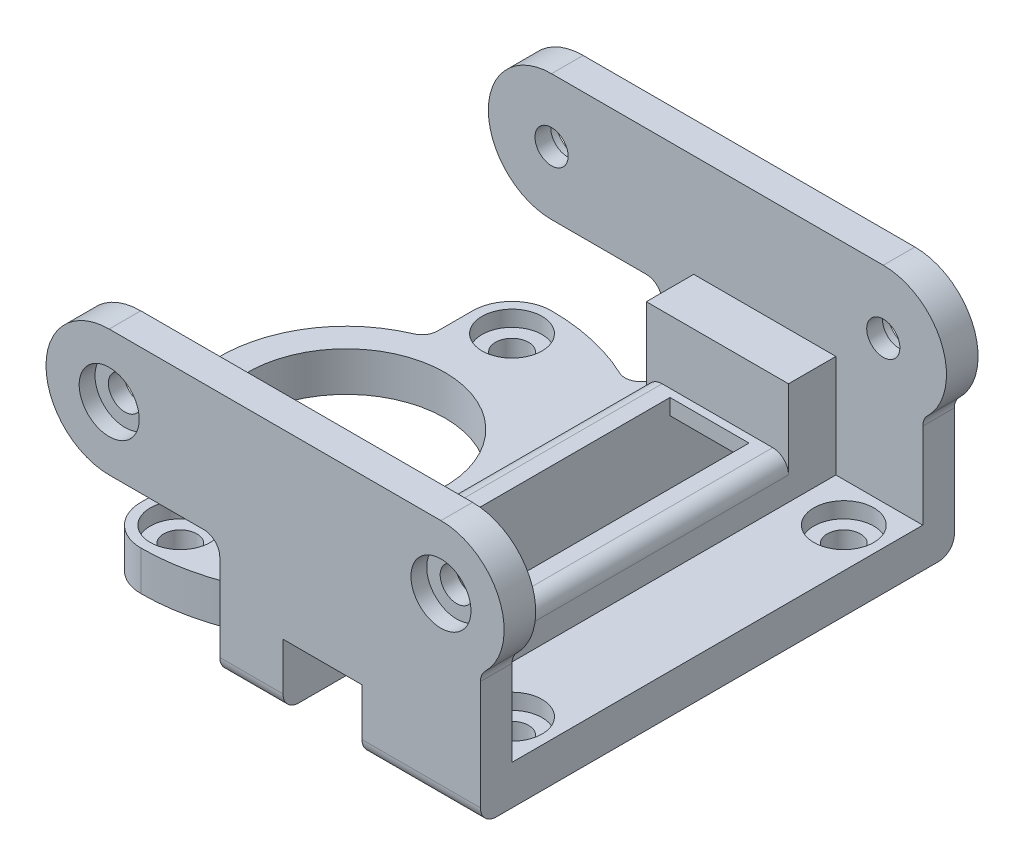
from build123d import *

# Parameters (mm, degrees)
EXTRUDE_1_DEPTH              = 14.5
HOLE_START                   = -15
HOLE_WIZARD_M2_1_OUTLINE_R   = 1.9
HOLE_WIZARD_M2_1_DEPTH       = 1
HOLE_START_2                 = -14
HOLE_WIZARD_M2_1_2_OUTLINE_R = 1.05
HOLE_WIZARD_M2_1_2_DEPTH     = 1
SKETCH_5_R                   = 8
EXTRUDE_2_DEPTH              = 2.5
SKETCH_10_W                  = 3
SKETCH_10_H                  = 10
CUT_EXTRUDE_4_DEPTH          = 37.087567111
SKETCH_9_W                   = 13
SKETCH_9_H                   = 5
CUT_EXTRUDE_3_DEPTH          = 37.087567111
FILLET_1_R                   = 4
CUT_EXTRUDE_START            = -2.5
CUT_EXTRUDE_5_OUTLINE_R      = 6.25
CUT_EXTRUDE_5_DEPTH          = 2.5
HOLE_WIZARD_M2_2_D           = 2.1
HOLE_WIZARD_M2_2_CBORE_D     = 3.8
HOLE_WIZARD_M2_2_CBORE_DEPTH = 1
FILLET_4_R                   = 2.5
FILLET_5_R                   = 1
SKETCH_14_W                  = 9
SKETCH_14_H                  = 26
EXTRUDE_4_DEPTH              = 6.5
CUT_EXTRUDE_6_REACH          = 33.001
SKETCH_15_W                  = 20
SKETCH_15_H                  = 4
CUT_EXTRUDE_7_REACH          = 38.088
SKETCH_16_W                  = 5
SKETCH_16_H                  = 4
CUT_EXTRUDE_8_REACH          = 28.448
SKETCH_17_W                  = 5
SKETCH_17_H                  = 19
CUT_EXTRUDE_9_DEPTH          = 37.087567111
FILLET_6_R                   = 1


# Read off the part's stored shape, not the designer's step: M2 丸平ねじ用座ぐり穴1, ｶｯﾄ - 押し出し5
with BuildPart() as part:
    # ｽｹｯﾁ1 → ﾎﾞｽ - 押し出し1 (new, symmetric)
    with BuildSketch(Plane(origin=(0, 0, 0), x_dir=(0, 0, -1), z_dir=(1, 0, 0))):
        Polygon((-15, -7.75), (15, -7.75), (15, 7.75), (13, 7.75), (13, -5.25), (-13, -5.25), (-13, 7.75), (-15, 7.75), align=None)
    extrude(amount=EXTRUDE_1_DEPTH, both=True)

    # M2 丸平ねじ用座ぐり穴1 outline → M2 丸平ねじ用座ぐり穴1 (cut)
    with BuildSketch(Plane.XY.offset(HOLE_START)):
        with Locations((-10.5, 3.75)):
            Circle(HOLE_WIZARD_M2_1_OUTLINE_R)
        with Locations((10.5, 3.75)):
            Circle(HOLE_WIZARD_M2_1_OUTLINE_R)
    hole_wizard_m2_1 = extrude(amount=HOLE_WIZARD_M2_1_DEPTH, mode=Mode.SUBTRACT)

    # Hole Wizard M2 _1 2 outline → Hole Wizard M2 _1 2 (cut)
    with BuildSketch(Plane.XY.offset(HOLE_START_2)):
        with Locations((-10.5, 3.75)):
            Circle(HOLE_WIZARD_M2_1_2_OUTLINE_R)
        with Locations((10.5, 3.75)):
            Circle(HOLE_WIZARD_M2_1_2_OUTLINE_R)
    hole_wizard_m2_1_2 = extrude(amount=HOLE_WIZARD_M2_1_2_DEPTH, mode=Mode.SUBTRACT)

    # ｽｹｯﾁ5 → ﾎﾞｽ - 押し出し2 (add)
    with BuildSketch(Plane.XZ.offset(7.75)):
        with Locations((-10.5, 0)):
            Circle(SKETCH_5_R)
    extrude(amount=-EXTRUDE_2_DEPTH)

    # ｽｹｯﾁ10 → ｶｯﾄ - 押し出し4 (cut, through all)
    with BuildSketch(Plane(origin=(0, 0, -15), x_dir=(-1, 0, 0), z_dir=(0, 0, -1))):
        with Locations((-14.5, -5.25)):
            Rectangle(SKETCH_10_W, SKETCH_10_H)
    extrude(amount=-CUT_EXTRUDE_4_DEPTH, mode=Mode.SUBTRACT)

    # ｽｹｯﾁ9 → ｶｯﾄ - 押し出し3 (cut, through all)
    with BuildSketch(Plane(origin=(0, 0, -15), x_dir=(-1, 0, 0), z_dir=(0, 0, -1))):
        with Locations((10, -2.75)):
            Rectangle(SKETCH_9_W, SKETCH_9_H)
    extrude(amount=-CUT_EXTRUDE_3_DEPTH, mode=Mode.SUBTRACT)

    # ﾌｨﾚｯﾄ1
    fillet_1_edges = [part.edges().sort_by_distance(p)[0] for p in [
        (-14.5, 7.75, 14),
        (14.5, 7.75, 14),
        (14.5, 7.75, -14),
        (-14.5, 7.75, -14),
        (-14.5, -0.25, 14),
        (-14.5, -0.25, -14),
    ]]
    fillet(fillet_1_edges, radius=FILLET_1_R - 0.0001)  # a hair under: the kernel refuses the full size

    # ｶｯﾄ - 押し出し5 outline → ｶｯﾄ - 押し出し5 (cut)
    with BuildSketch(Plane.XZ.offset(7.75).offset(CUT_EXTRUDE_START)):
        with BuildLine():
            Line((-14.5, -15), (-3.5, -15))
            Line((-3.5, -15), (-3.5, -10.95445115))
            ThreePointArc((-3.5, -10.95445115), (-8.076137007, -12.772035397), (-13, -12.757350822))
            Line((-13, -12.757350822), (-13, -7.599342077))
            ThreePointArc((-13, -7.599342077), (-13.7672782, -7.302389552), (-14.5, -6.92820323))
            Line((-14.5, -6.92820323), (-14.5, -15))
        make_face()
        with BuildLine():
            Line((-14.5, 15), (-14.5, 6.92820323))
            ThreePointArc((-14.5, 6.92820323), (-13.7672782, 7.302389552), (-13, 7.599342077))
            Line((-13, 7.599342077), (-13, 12.757350822))
            ThreePointArc((-13, 12.757350822), (-8.076137007, 12.772035397), (-3.5, 10.95445115))
            Line((-3.5, 10.95445115), (-3.5, 15))
            Line((-3.5, 15), (-14.5, 15))
        make_face()
        with Locations((-10.5, 0)):
            Circle(CUT_EXTRUDE_5_OUTLINE_R)
    extrude(amount=CUT_EXTRUDE_5_DEPTH, mode=Mode.SUBTRACT)

    # M2 丸平ねじ用座ぐり穴2 (through all)
    with Locations(Plane(origin=(0, -5.25, 0), x_dir=(1, 0, 0), z_dir=(0, 1, 0))):
        with Locations((10.5, -10.5), (10.5, 10.5), (-10.5, 10.5), (-10.5, -10.5)):
            CounterBoreHole(HOLE_WIZARD_M2_2_D / 2, HOLE_WIZARD_M2_2_CBORE_D / 2, HOLE_WIZARD_M2_2_CBORE_DEPTH)

    # ﾌｨﾚｯﾄ4
    fillet_4_edges = [part.edges().sort_by_distance(p)[0] for p in [
        (-13, -6.5, -12.757350822),
        (-13, -6.5, 12.757350822),
    ]]
    fillet(fillet_4_edges, radius=FILLET_4_R - 0.0001)  # a hair under: the kernel refuses the full size

    # ﾌｨﾚｯﾄ5
    fillet_5_edges = [part.edges().sort_by_distance(p)[0] for p in [
        (-3.5, -6.5, -10.95445115),
        (-13, -6.5, -7.599342077),
        (-13, -6.5, 7.599342077),
        (-3.5, -6.5, 10.95445115),
    ]]
    fillet(fillet_5_edges, radius=FILLET_5_R)

    # ｽｹｯﾁ14 → ﾎﾞｽ - 押し出し4 (add)
    with BuildSketch(Plane(origin=(0, -5.25, 0), x_dir=(1, 0, 0), z_dir=(0, 1, 0))):
        with Locations((3, 0)):
            Rectangle(SKETCH_14_W, SKETCH_14_H)
    extrude(amount=EXTRUDE_4_DEPTH)

    # ｽｹｯﾁ15 → ｶｯﾄ - 押し出し6 (cut, up to next)
    with BuildSketch(Plane(origin=(7.5, 0, 0), x_dir=(0, 0, -1), z_dir=(1, 0, 0)), mode=Mode.PRIVATE) as cut_extrude_6_sk1:
        with Locations((0, -0.75)):
            Rectangle(SKETCH_15_W, SKETCH_15_H)
    cut_extrude_6_tool1 = extrude(cut_extrude_6_sk1.sketch, amount=-CUT_EXTRUDE_6_REACH, mode=Mode.PRIVATE) & part.part
    add(cut_extrude_6_tool1.solids().sort_by_distance((7.5, -0.75, 0))[0], mode=Mode.SUBTRACT)

    # ｽｹｯﾁ16 → ｶｯﾄ - 押し出し7 (cut, up to next)
    with BuildSketch(Plane(origin=(0, 0, -15), x_dir=(-1, 0, 0), z_dir=(0, 0, -1)), mode=Mode.PRIVATE) as cut_extrude_7_sk1:
        with Locations((-3, -5.75)):
            Rectangle(SKETCH_16_W, SKETCH_16_H)
    cut_extrude_7_tool1 = extrude(cut_extrude_7_sk1.sketch, amount=-CUT_EXTRUDE_7_REACH, mode=Mode.PRIVATE) & part.part
    add(cut_extrude_7_tool1.solids().sort_by_distance((3, -5.75, -15))[0], mode=Mode.SUBTRACT)

    # ｽｹｯﾁ17 → ｶｯﾄ - 押し出し8 (cut, up to next)
    with BuildSketch(Plane.XZ.offset(3.75), mode=Mode.PRIVATE) as cut_extrude_8_sk1:
        with Locations((3, 0)):
            Rectangle(SKETCH_17_W, SKETCH_17_H)
    cut_extrude_8_tool1 = extrude(cut_extrude_8_sk1.sketch, amount=-CUT_EXTRUDE_8_REACH, mode=Mode.PRIVATE) & part.part
    add(cut_extrude_8_tool1.solids().sort_by_distance((3, -3.75, 0))[0], mode=Mode.SUBTRACT)

    # ﾐﾗｰ1: M2 丸平ねじ用座ぐり穴1, Hole Wizard M2 _1 2 across plane
    add(hole_wizard_m2_1.mirror(Plane.XY), mode=Mode.SUBTRACT)
    add(hole_wizard_m2_1_2.mirror(Plane.XY), mode=Mode.SUBTRACT)

    # ｽｹｯﾁ18 → ｶｯﾄ - 押し出し9 (cut, through all)
    with BuildSketch(Plane(origin=(0, 0, -15), x_dir=(-1, 0, 0), z_dir=(0, 0, -1))):
        with BuildLine():
            Line((-14.5, 3.75), (-14.5, -0.25))
            Line((-14.5, -0.25), (-13, -0.25))
            Line((-13, -0.25), (-13, 0.627501001))
            ThreePointArc((-13, 0.627501001), (-14.105551275, 2.017949192), (-14.5, 3.75))
        make_face()
    extrude(amount=-CUT_EXTRUDE_9_DEPTH, mode=Mode.SUBTRACT)

    # ﾌｨﾚｯﾄ6
    fillet_6_edges = [part.edges().sort_by_distance(p)[0] for p in [
        (7.5, -2.75, 0),
        (-1.5, -2.75, 0),
        (-1.5, -7.75, -15),
        (-1.5, -7.75, 15),
        (13, 0.627501001, 14),
        (13, 0.627501001, -14),
        (9.25, -7.75, -15),
        (9.25, -7.75, 15),
        (-3.5, -0.25, 14),
        (-3.5, -0.25, -14),
    ]]
    fillet(fillet_6_edges, radius=FILLET_6_R)


solid = part.part
